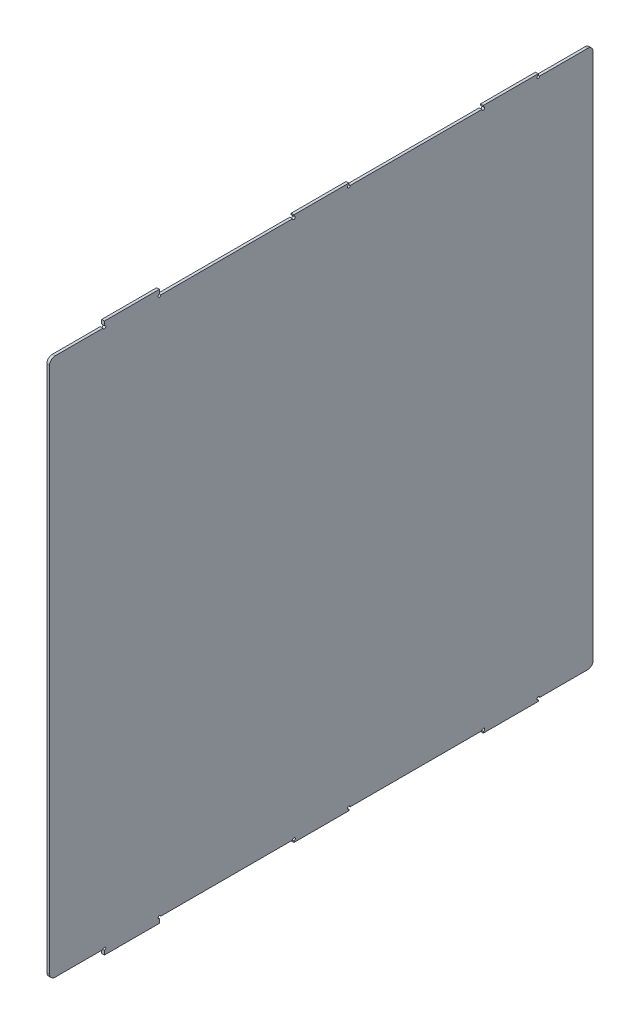
from build123d import *

# Parameters (mm, degrees)
T_LE_DE_BASE_PLI_E1_DEPTH = 1
ESQUISSE3_R               = 0.5
ENL_V_MAT_EXTRU_1_DEPTH   = 141.719579306


# Sheet-metal steps are written as plain solids
with BuildPart() as part:
    # Esquisse1 → Tôle de base pliée1 (new body)
    with BuildSketch(Plane(origin=(0, 0, 0), x_dir=(0, 0, -1), z_dir=(1, 0, 0))):
        with BuildLine():
            Line((-99, -96), (-99, 96))
            ThreePointArc((-99, 96), (-98.414213562, 97.414213562), (-97, 98))
            Line((-97, 98), (-79, 98))
            Line((-79, 98), (-79, 100))
            Line((-79, 100), (-59, 100))
            Line((-59, 100), (-59, 98))
            Line((-59, 98), (-10, 98))
            Line((-10, 98), (-10, 99))
            Line((-10, 99), (10, 99))
            Line((10, 99), (10, 98))
            Line((10, 98), (59, 98))
            Line((59, 98), (59, 99))
            Line((59, 99), (79, 99))
            Line((79, 99), (79, 98))
            Line((79, 98), (97, 98))
            ThreePointArc((97, 98), (98.414213562, 97.414213562), (99, 96))
            Line((99, 96), (99, -96))
            ThreePointArc((99, -96), (98.414213562, -97.414213562), (97, -98))
            Line((97, -98), (79, -98))
            Line((79, -98), (79, -99))
            Line((79, -99), (59, -99))
            Line((59, -99), (59, -98))
            Line((59, -98), (10, -98))
            Line((10, -98), (10, -99))
            Line((10, -99), (-10, -99))
            Line((-10, -99), (-10, -98))
            Line((-10, -98), (-59, -98))
            Line((-59, -98), (-59, -100))
            Line((-59, -100), (-79, -100))
            Line((-79, -100), (-79, -98))
            Line((-79, -98), (-97, -98))
            ThreePointArc((-97, -98), (-98.414213562, -97.414213562), (-99, -96))
        make_face()
    extrude(amount=-T_LE_DE_BASE_PLI_E1_DEPTH)

    # Esquisse3 → Enlèv. mat.-Extru.1 (cut, through all)
    with BuildSketch(Plane(origin=(0, 0, 0), x_dir=(0, 0, -1), z_dir=(1, 0, 0))):
        with Locations((-79, 98)):
            Circle(ESQUISSE3_R)
        with Locations((-59, 98)):
            Circle(ESQUISSE3_R)
        with Locations((-10, 98)):
            Circle(ESQUISSE3_R)
        with Locations((10, 98)):
            Circle(ESQUISSE3_R)
        with Locations((59, 98)):
            Circle(ESQUISSE3_R)
        with Locations((79, 98)):
            Circle(ESQUISSE3_R)
        with Locations((79, -98)):
            Circle(ESQUISSE3_R)
        with Locations((59, -98)):
            Circle(ESQUISSE3_R)
        with Locations((10, -98)):
            Circle(ESQUISSE3_R)
        with Locations((-10, -98)):
            Circle(ESQUISSE3_R)
        with Locations((-59, -98)):
            Circle(ESQUISSE3_R)
        with Locations((-79, -98)):
            Circle(ESQUISSE3_R)
    extrude(amount=-ENL_V_MAT_EXTRU_1_DEPTH, mode=Mode.SUBTRACT)


solid = part.part
